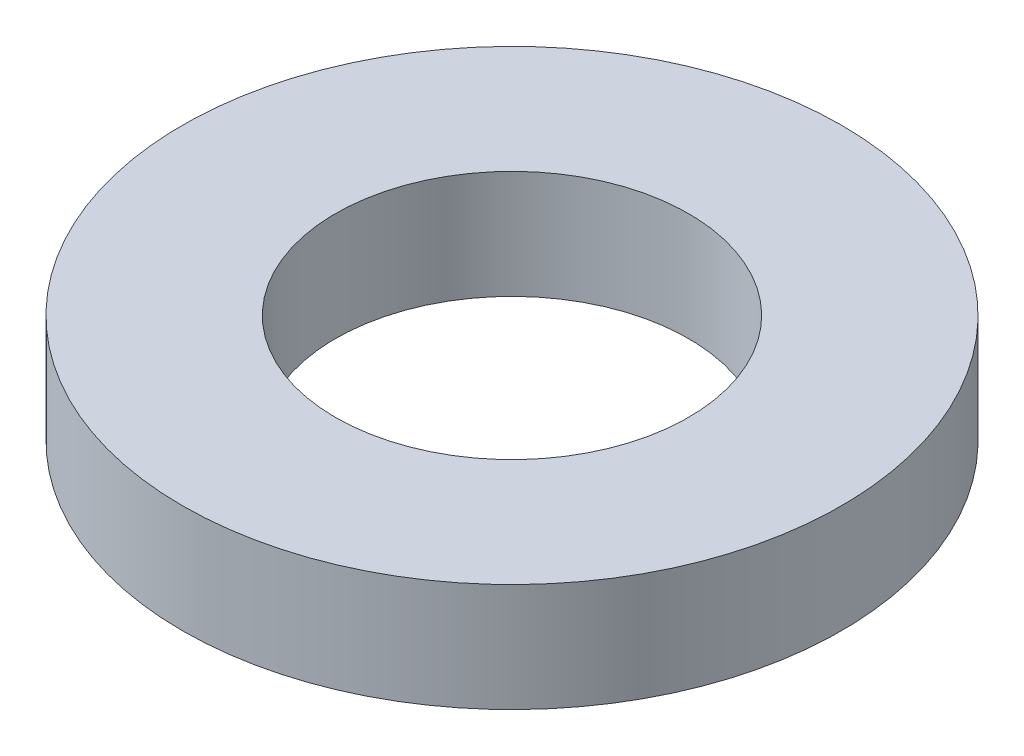
from build123d import *

# Parameters (mm, degrees)
SKETCH1_R           = 70
BOSS_EXTRUDE1_DEPTH = 23
SKETCH2_R           = 37.5
CUT_EXTRUDE1_DEPTH  = 102.631687972


with BuildPart() as part:
    # Sketch1 → Boss-Extrude1 (new body)
    with BuildSketch(Plane(origin=(0, 0, 0), x_dir=(1, 0, 0), z_dir=(0, 1, 0))):
        Circle(SKETCH1_R)
    extrude(amount=BOSS_EXTRUDE1_DEPTH)

    # Sketch2 → Cut-Extrude1 (cut, through all)
    with BuildSketch(Plane(origin=(0, 0, 0), x_dir=(1, 0, 0), z_dir=(0, 1, 0))):
        Circle(SKETCH2_R)
    extrude(amount=CUT_EXTRUDE1_DEPTH, mode=Mode.SUBTRACT)


solid = part.part
